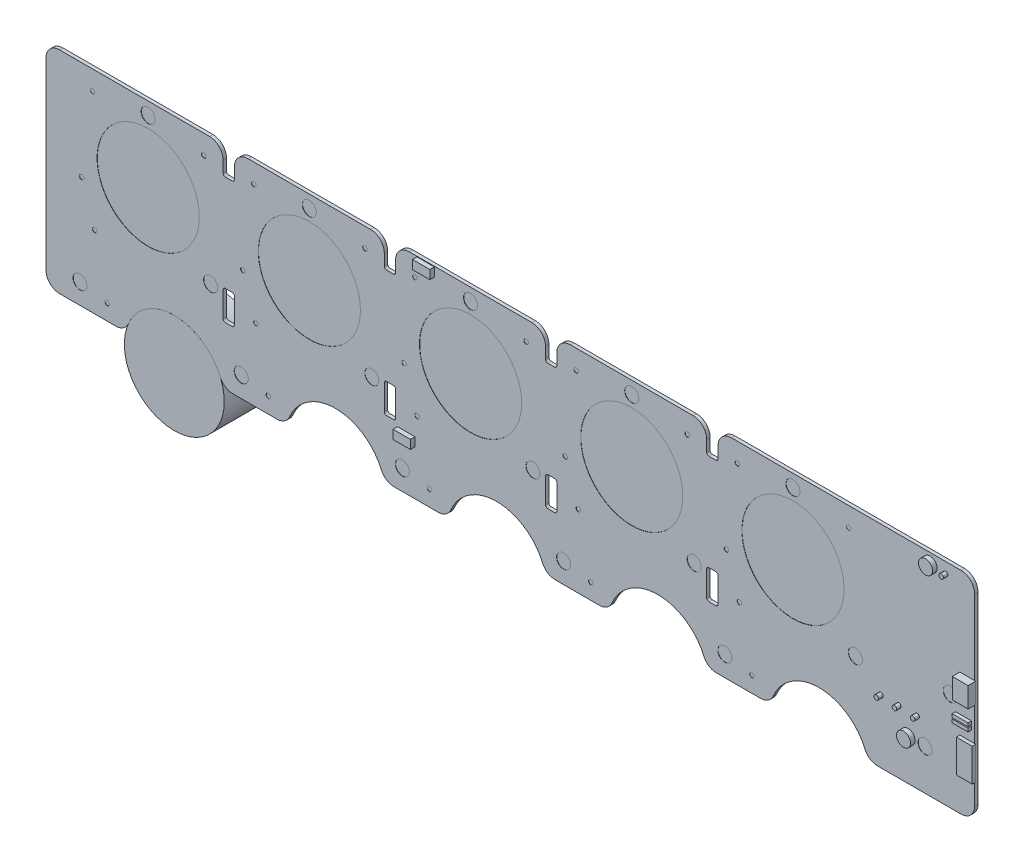
from build123d import *

# Parameters (mm, degrees)
ESQUISSE1_W                                = 409
ESQUISSE1_H                                = 93
PCB_RECTANGULAIRE_DEPTH                    = 1.5
ESQUISSE1_3_R                              = 22.5
POSITION_TROU_DEPTH                        = 0.1
PASSAGE_APPUI_FLANC_ET_PASSAGE_JETON_DEPTH = 230.970106753
R_P_TITION_LIN_AIRE1_COUNT                 = 4
R_P_TITION_LIN_AIRE1_PITCH                 = 71
ESQUISSE2_R                                = 1
ESQUISSE2_R_2                              = 3.1
POSITION_CAPTEUR_LED_DEPTH                 = 0.1
ESQUISSE4_R                                = 22
ECHAPPEMENT_DEPTH                          = 230.970106753
R_P_TITION_LIN_AIRE3_COUNT                 = 5
R_P_TITION_LIN_AIRE3_PITCH                 = 71
CONG_1_R                                   = 6
ESQUISSE5_R                                = 1
ESQUISSE5_R_2                              = 3.1
ESQUISSE5_W                                = 7.707134
ESQUISSE5_H                                = 3.889125
BOUTON_ET_IR_DEPTH                         = 2
COTE_DROIT_START                           = 0.5
ESQUISSE6_W                                = 3.335002
ESQUISSE6_H                                = 8.94
ESQUISSE6_W_2                              = 1.535001209
ESQUISSE6_H_2                              = 14.45
ESQUISSE6_W_3                              = 1.5
ESQUISSE6_H_3                              = 1.5
COTE_DROIT_DEPTH                           = 7
ESQUISSE4_2_R                              = 22
DEGAGEMENT_JETON_DEPTH                     = 20


with BuildPart() as part:
    # Esquisse1 → PCB_rectangulaire (new body)
    with BuildSketch(Plane.XY):
        with Locations((17.5, -13.5)):
            Rectangle(ESQUISSE1_W, ESQUISSE1_H)
    extrude(amount=-PCB_RECTANGULAIRE_DEPTH)

    # Esquisse1<3> → position_trou (cut)
    with BuildSketch(Plane.XY):
        with Locations((-142, 0)):
            Circle(ESQUISSE1_3_R)
        with Locations((-71, 0)):
            Circle(ESQUISSE1_3_R)
        Circle(ESQUISSE1_3_R)
        with Locations((71, 0)):
            Circle(ESQUISSE1_3_R)
        with Locations((142, 0)):
            Circle(ESQUISSE1_3_R)
    extrude(amount=-POSITION_TROU_DEPTH, mode=Mode.SUBTRACT)

    # Esquisse3 → passage_appui_flanc et passage jeton (cut, through all)
    with BuildSketch(Plane.XY):
        with BuildLine():
            Line((-109, 33), (-104, 33))
            Line((-104, 33), (-104, 22))
            ThreePointArc((-104, 22), (-104.292893219, 21.292893219), (-105, 21))
            Line((-105, 21), (-108, 21))
            ThreePointArc((-108, 21), (-108.707106781, 21.292893219), (-109, 22))
            Line((-109, 22), (-109, 33))
        make_face()
        with BuildLine():
            Line((-108, -21.5), (-105, -21.5))
            ThreePointArc((-105, -21.5), (-104.292893219, -21.792893219), (-104, -22.5))
            Line((-104, -22.5), (-104, -33.5))
            ThreePointArc((-104, -33.5), (-104.292893219, -34.207106781), (-105, -34.5))
            Line((-105, -34.5), (-108, -34.5))
            ThreePointArc((-108, -34.5), (-108.707106781, -34.207106781), (-109, -33.5))
            Line((-109, -33.5), (-109, -22.5))
            ThreePointArc((-109, -22.5), (-108.707106781, -21.792893219), (-108, -21.5))
        make_face()
    passage_appui_flanc_et_passage_jeton = extrude(amount=-PASSAGE_APPUI_FLANC_ET_PASSAGE_JETON_DEPTH, mode=Mode.SUBTRACT)

    # Répétition linéaire1: passage_appui_flanc et passage jeton ×4
    with Locations(*[(i * R_P_TITION_LIN_AIRE1_PITCH, 0, 0) for i in range(1, R_P_TITION_LIN_AIRE1_COUNT)]):
        add(passage_appui_flanc_et_passage_jeton, mode=Mode.SUBTRACT)

    # Esquisse2 → position_capteur-LED (cut)
    with BuildSketch(Plane.XY):
        with Locations((-171.292893219, -10.707106781)):
            Circle(ESQUISSE2_R)
        with Locations((-165.54936099, -28)):
            Circle(ESQUISSE2_R)
        with Locations((-160.056223834, -53.056223834)):
            Circle(ESQUISSE2_R)
        with Locations((-166.492120637, 24.492120637)):
            Circle(ESQUISSE2_R)
        with Locations((-117.507879363, 24.492120637)):
            Circle(ESQUISSE2_R)
        with Locations((-172, -51)):
            Circle(ESQUISSE2_R_2)
        with Locations((-114.5, -23)):
            Circle(ESQUISSE2_R_2)
        with Locations((-142, 27.5)):
            Circle(ESQUISSE2_R_2)
        with Locations((211.29236, -16.587496544)):
            Circle(ESQUISSE2_R_2)
        with Locations((200.19236, -42.087496544)):
            Circle(ESQUISSE2_R_2)
    position_capteur_led = extrude(amount=-POSITION_CAPTEUR_LED_DEPTH, mode=Mode.SUBTRACT)

    # Esquisse4 → echappement (cut, through all)
    with BuildSketch(Plane.XY):
        with Locations((-130.5, -65)):
            Circle(ESQUISSE4_R)
    echappement = extrude(amount=-ECHAPPEMENT_DEPTH, mode=Mode.SUBTRACT)

    # Répétition linéaire3: position_capteur-LED, echappement ×5
    with Locations(*[(i * R_P_TITION_LIN_AIRE3_PITCH, 0, 0) for i in range(1, R_P_TITION_LIN_AIRE3_COUNT)]):
        add(position_capteur_led, mode=Mode.SUBTRACT)
        add(echappement, mode=Mode.SUBTRACT)

    # Congé1
    cong_1_edges = [part.edges().sort_by_distance(p)[0] for p in [
        (-187, -60, -0.75),
        (-187, 33, -0.75),
        (-109, 33, -0.75),
        (-104, 33, -0.75),
        (-38, 33, -0.75),
        (-33, 33, -0.75),
        (33, 33, -0.75),
        (38, 33, -0.75),
        (104, 33, -0.75),
        (109, 33, -0.75),
        (222, 33, -0.75),
        (222, -60, -0.75),
        (-109.075714714, -60, -0.75),
        (-151.924285286, -60, -0.75),
        (174.924285286, -60, -0.75),
        (132.075714714, -60, -0.75),
        (103.924285286, -60, -0.75),
        (61.075714714, -60, -0.75),
        (32.924285286, -60, -0.75),
        (-9.924285286, -60, -0.75),
        (-38.075714714, -60, -0.75),
        (-80.924285286, -60, -0.75),
    ]]
    fillet(cong_1_edges, radius=CONG_1_R)

    # Esquisse5 → bouton et IR (add)
    with BuildSketch(Plane.XY):
        with Locations((180.69236, -32.187496544)):
            Circle(ESQUISSE5_R)
        with Locations((188.69236, -32.187496544)):
            Circle(ESQUISSE5_R)
        with Locations((196.69236, -32.187496544)):
            Circle(ESQUISSE5_R)
        with Locations((209.239488, 28.264213456)):
            Circle(ESQUISSE5_R)
        with Locations((192.69236, -42.087496544)):
            Circle(ESQUISSE5_R_2)
        with Locations((202.39236, 28.512503456)):
            Circle(ESQUISSE5_R_2)
        with Locations((-19.775015, 30.807550956)):
            Rectangle(ESQUISSE5_W, ESQUISSE5_H)
        with Locations((-28.322143, -38.242450044)):
            Rectangle(ESQUISSE5_W, ESQUISSE5_H)
    extrude(amount=BOUTON_ET_IR_DEPTH)

    # Esquisse6 → cote_droit (add)
    with BuildSketch(Plane(origin=(222, 0, 0), x_dir=(0, 0, -1), z_dir=(1, 0, 0)).offset(COTE_DROIT_START)):
        with Locations((-1.667501, -10.537494544)):
            Rectangle(ESQUISSE6_W, ESQUISSE6_H)
        with Locations((-0.767500605, -37.337443744)):
            Rectangle(ESQUISSE6_W_2, ESQUISSE6_H_2)
        with Locations((-2.65, -22.987496544)):
            Rectangle(ESQUISSE6_W_3, ESQUISSE6_H_3)
        with Locations((-2.65, -20.987496544)):
            Rectangle(ESQUISSE6_W_3, ESQUISSE6_H_3)
    extrude(amount=-COTE_DROIT_DEPTH)


with BuildPart() as cote_droit_piece_1:
    # of the separate pieces the step leaves, piece 1, a body of its own (cote_droit_pieces)
    add(part.part.solids().sort_by_distance((-181, 33, 0))[0])


with BuildPart() as cote_droit_piece_2:
    # of the separate pieces the step leaves, piece 2, a body of its own (cote_droit_pieces)
    add(part.part.solids().sort_by_distance((222.5, -22.237496544, 3.4))[0])


with BuildPart() as cote_droit_piece_3:
    # of the separate pieces the step leaves, piece 3, a body of its own (cote_droit_pieces)
    add(part.part.solids().sort_by_distance((222.5, -20.237496544, 3.4))[0])


with BuildPart() as body_4:
    # Esquisse4<2> → degagement_jeton (new body)
    with BuildSketch(Plane.XY):
        with Locations((-130.5, -65)):
            Circle(ESQUISSE4_2_R)
    extrude(amount=-DEGAGEMENT_JETON_DEPTH)


solid = Compound([cote_droit_piece_1.part, cote_droit_piece_2.part, cote_droit_piece_3.part, body_4.part])
